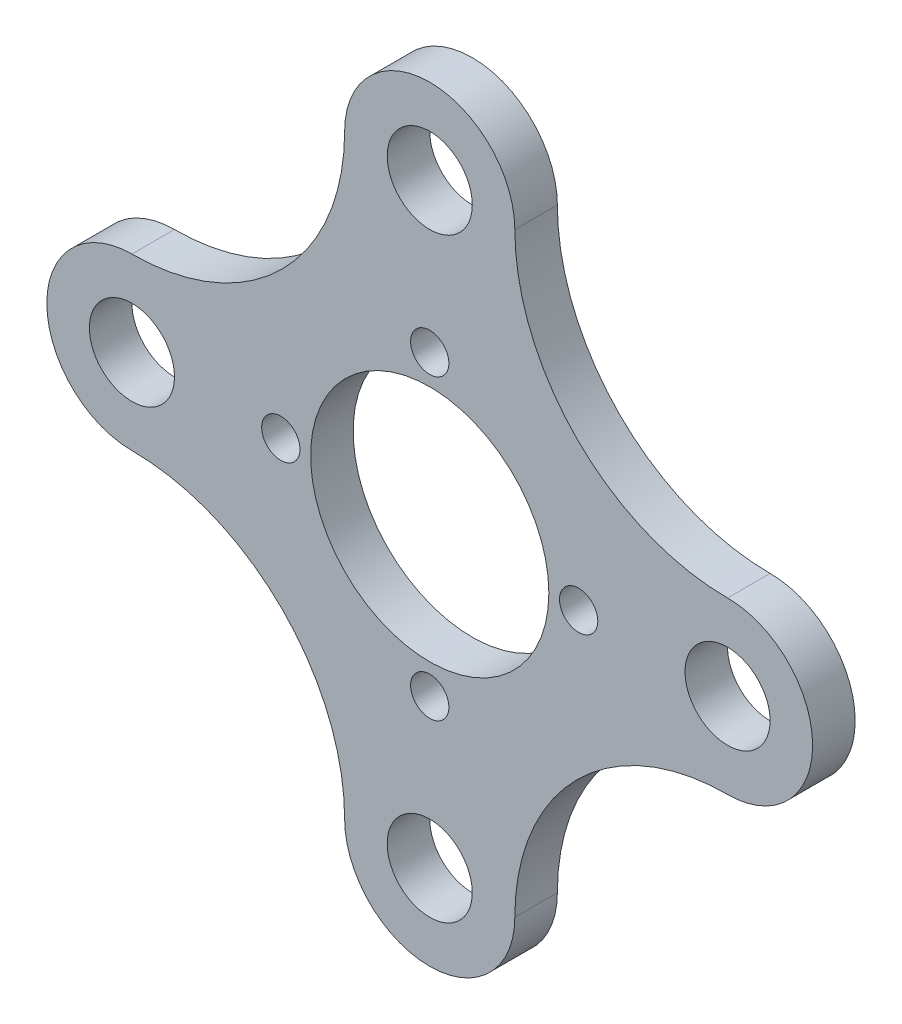
from build123d import *

# Parameters (mm, degrees)
SZKIC1_R                    = 24
SZKIC1_R_2                  = 14
SZKIC1_R_3                  = 2.25
DODANIE_WYCI_GNI_CIE1_DEPTH = 5
DODANIE_WYCI_GNI_CIE2_START = -5
SZKIC2_R                    = 5
SZKIC2_R_2                  = 2.25
SZKIC2_R_3                  = 14
DODANIE_WYCI_GNI_CIE2_DEPTH = 5


with BuildPart() as part:
    # Szkic1 → Dodanie-wyciągnięcie1 (new body)
    with BuildSketch(Plane.XY):
        Circle(SZKIC1_R)
        Circle(SZKIC1_R_2, mode=Mode.SUBTRACT)
        with Locations((17.5, 0)):
            Circle(SZKIC1_R_3, mode=Mode.SUBTRACT)
        with Locations((0, -17.5)):
            Circle(SZKIC1_R_3, mode=Mode.SUBTRACT)
        with Locations((-17.5, 0)):
            Circle(SZKIC1_R_3, mode=Mode.SUBTRACT)
        with Locations((0, 17.5)):
            Circle(SZKIC1_R_3, mode=Mode.SUBTRACT)
    extrude(amount=DODANIE_WYCI_GNI_CIE1_DEPTH)

    # Szkic2 → Dodanie-wyciągnięcie2 (add)
    with BuildSketch(Plane.XY.offset(5).offset(DODANIE_WYCI_GNI_CIE2_START)):
        with BuildLine():
            ThreePointArc((-10, -35), (0, -45), (10, -35))
            ThreePointArc((10, -35), (17.32233047, -17.32233047), (35, -10))
            ThreePointArc((35, -10), (45, 0), (35, 10))
            ThreePointArc((35, 10), (17.32233047, 17.32233047), (10, 35))
            ThreePointArc((10, 35), (0, 45), (-10, 35))
            ThreePointArc((-10, 35), (-17.32233047, 17.32233047), (-35, 10))
            ThreePointArc((-35, 10), (-45, 0), (-35, -10))
            ThreePointArc((-35, -10), (-17.32233047, -17.32233047), (-10, -35))
        make_face()
        with Locations((0, -35)):
            Circle(SZKIC2_R, mode=Mode.SUBTRACT)
        with Locations((-35, 0)):
            Circle(SZKIC2_R, mode=Mode.SUBTRACT)
        with Locations((0, 17.5)):
            Circle(SZKIC2_R_2, mode=Mode.SUBTRACT)
        Circle(SZKIC2_R_3, mode=Mode.SUBTRACT)
        with Locations((17.5, 0)):
            Circle(SZKIC2_R_2, mode=Mode.SUBTRACT)
        with Locations((0, -17.5)):
            Circle(SZKIC2_R_2, mode=Mode.SUBTRACT)
        with Locations((-17.5, 0)):
            Circle(SZKIC2_R_2, mode=Mode.SUBTRACT)
        with Locations((35, 0)):
            Circle(SZKIC2_R, mode=Mode.SUBTRACT)
        with Locations((0, 35)):
            Circle(SZKIC2_R, mode=Mode.SUBTRACT)
    extrude(amount=DODANIE_WYCI_GNI_CIE2_DEPTH)


solid = part.part
